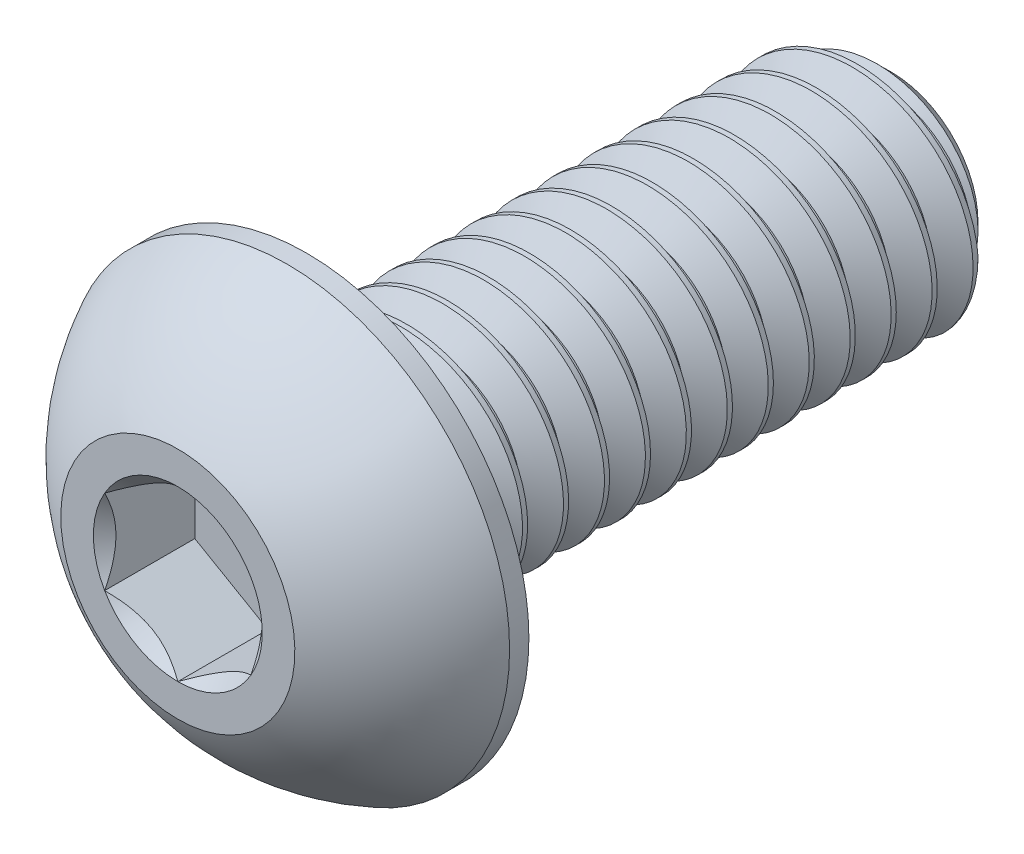
from build123d import *

# Parameters (mm, degrees)
SKETCH1_W          = 10
SKETCH1_H          = 2
CHAMFER1_SIZE      = 0.525
CUT_SWEEP1_PITCH   = 0.7
CUT_EXTRUDE2_DEPTH = 1.54


with BuildPart() as part:
    # Sketch1 → Revolve1 (revolve)
    with BuildSketch(Plane(origin=(0, 0, 0), x_dir=(0, 0, -1), z_dir=(1, 0, 0))):
        with Locations((7.2, 1)):
            Rectangle(SKETCH1_W, SKETCH1_H)
    revolve(axis=Axis((0, 0, -12.2), (0, 0, 1)))

    # Chamfer1
    chamfer1_edges = [part.edges().sort_by_distance(p)[0] for p in [
        (0, -2, -12.2),
    ]]
    chamfer(chamfer1_edges, length=CHAMFER1_SIZE)

    # Cut-Sweep1: the profile of Sketch2 profile screwed along a right-hand helix of 15.285714 turns, 6 arcs to a turn; built about Z, then put on its axis
    cut_sweep1_z = Axis((0, 0, 0), (0, 0, 1))
    cut_sweep1_corners = [(2.0003, 0, 0.000173205), (2.0003, 0, -0.612673205), (1.545336663, 0, -0.35), (1.545336663, 0, -0.2625)]
    with BuildLine(mode=Mode.PRIVATE) as cut_sweep1_profile:
        Line(cut_sweep1_corners[0], cut_sweep1_corners[1])
        Line(cut_sweep1_corners[1], cut_sweep1_corners[2])
        Line(cut_sweep1_corners[2], cut_sweep1_corners[3])
        Line(cut_sweep1_corners[3], cut_sweep1_corners[0])
    cut_sweep1_cap = Face(cut_sweep1_profile.wire())
    cut_sweep1_turn_angles = [0, 30, 60, 90, 120, 150, 180, 210, 240, 270, 300, 330, 360]
    cut_sweep1_turn_weights = [1, 0.8660254037844387, 1, 0.8660254037844387, 1, 0.8660254037844387, 1, 0.8660254037844387, 1, 0.8660254037844387, 1, 0.8660254037844387, 1]
    cut_sweep1_turn_rails = [Edge.make_bspline([Vector(p[0], p[1], 0).rotate(cut_sweep1_z, cut_sweep1_turn_angles[k]) / cut_sweep1_turn_weights[k] + Vector(0, 0, p[2] + CUT_SWEEP1_PITCH * cut_sweep1_turn_angles[k] / 360) for k in range(13)], [0, 0, 0, 1, 1, 2, 2, 3, 3, 4, 4, 5, 5, 6, 6, 6], 2, cut_sweep1_turn_weights) for p in cut_sweep1_corners]
    cut_sweep1_turn_sides = [Face.make_surface_from_curves(cut_sweep1_turn_rails[p[0]], cut_sweep1_turn_rails[p[1]]) for p in [(0, 1), (1, 2), (2, 3), (3, 0)]]
    cut_sweep1_last_angles = [5400, 5430, 5460, 5481.428571429, 5502.857142857]
    cut_sweep1_last_weights = [1, 0.8660254037844387, 1, 0.9308737486442296, 1]
    cut_sweep1_last_rails = [Edge.make_bspline([Vector(p[0], p[1], 0).rotate(cut_sweep1_z, cut_sweep1_last_angles[k]) / cut_sweep1_last_weights[k] + Vector(0, 0, p[2] + CUT_SWEEP1_PITCH * cut_sweep1_last_angles[k] / 360) for k in range(5)], [0, 0, 0, 1, 1, 2, 2, 2], 2, cut_sweep1_last_weights) for p in cut_sweep1_corners]
    cut_sweep1_last_sides = [Face.make_surface_from_curves(cut_sweep1_last_rails[p[0]], cut_sweep1_last_rails[p[1]]) for p in [(0, 1), (1, 2), (2, 3), (3, 0)]]
    cut_sweep1 = Plane(origin=(0, 0, -12.2), x_dir=(0, 1, 0), z_dir=(0, 0, 1)) * Solid(Shell([*[p.moved(Location((0, 0, CUT_SWEEP1_PITCH * i))) for i in range(15) for p in cut_sweep1_turn_sides], *cut_sweep1_last_sides, cut_sweep1_cap, cut_sweep1_cap.rotate(cut_sweep1_z, 5502.857142857).moved(Location((0, 0, CUT_SWEEP1_PITCH * 5502.857142857 / 360)))]))
    add(cut_sweep1, mode=Mode.SUBTRACT)

    # Sketch7 → Revolve2 (revolve)
    with BuildSketch(Plane(origin=(0, 0, 0), x_dir=(0, 0, -1), z_dir=(1, 0, 0)), mode=Mode.PRIVATE) as revolve2_sk:
        with BuildLine():
            Line((1.87, 3.8), (2.2, 3.8))
            Line((2.2, 3.8), (2.2, 0))
            Line((2.2, 0), (0, 0))
            Line((0, 0), (0, 2))
            ThreePointArc((0, 2), (0.793500147, 3.047002626), (1.87, 3.8))
        make_face()
    revolve(revolve2_sk.sketch.rotate(Axis((0, 0, 0), (0, 0, -1)), 189.336081704), axis=Axis((0, 0, 0), (0, 0, -1)))

    # Sketch5 → Cut-Extrude2 (cut)
    with BuildSketch(Plane.XY):
        Polygon((1.25, -0.721687836), (1.25, 0.721687836), (0, 1.443375673), (-1.25, 0.721687836), (-1.25, -0.721687836), (0, -1.443375673), align=None)
    extrude(amount=-CUT_EXTRUDE2_DEPTH, mode=Mode.SUBTRACT)

    # Cut-Extrude3 cone 1 section (through the dimple's axis) → Cut-Extrude3 (revolve, cut)
    with BuildSketch(Plane(origin=(0, 0, 0), x_dir=(0, -1, 0), z_dir=(1, 0, 0))):
        Polygon((0, 0), (1.443375673, 0), (0, 1.443375673), align=None)
    revolve(axis=Axis((0, 0, 0), (0, 0, -1)), mode=Mode.SUBTRACT)


solid = part.part
